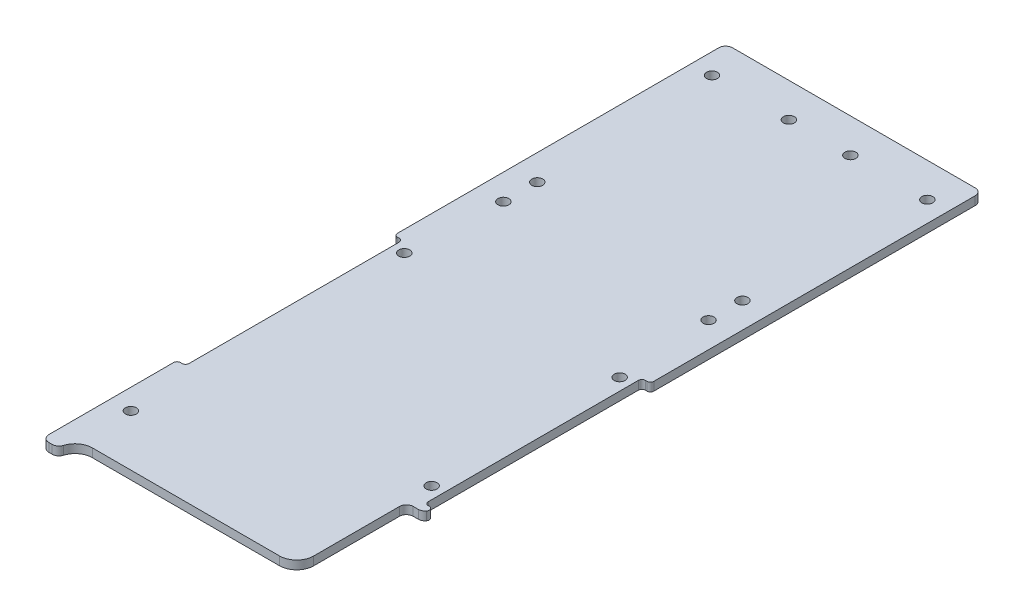
from build123d import *

# Parameters (mm, degrees)
SKETCH1_R               = 2.032
BOSS_EXTRUDE1_DEPTH     = 3.175
FILLET1_R               = 2.54
FILLET2_R               = 2.54
FILLET3_R               = 6.35
CUT_EXTRUDE1_DEPTH      = 136.673215063
FILLET4_R               = 6.35
FILLET5_R               = 2.54
SKETCH3_R               = 2.032
CUT_EXTRUDE2_DEPTH      = 136.673215063
CUT_EXTRUDE3_DEPTH      = 136.673215063
CUT_EXTRUDE3_DEPTH_BACK = 136.673215063
SKETCH4_W               = 3.175
SKETCH4_H               = 80.645
FILLET6_R               = 1.27


with BuildPart() as part:
    # Sketch1 → Boss-Extrude1 (new body)
    with BuildSketch(Plane(origin=(0, 0, 0), x_dir=(1, 0, 0), z_dir=(0, 1, 0))):
        Polygon((47.625, 127), (-47.625, 127), (-47.625, -127), (-41.275, -127), (-41.275, -120.65), (41.275, -120.65), (41.275, -127), (47.625, -127), align=None)
        with Locations((-39.999684148, -101.6)):
            Circle(SKETCH1_R, mode=Mode.SUBTRACT)
        with Locations((39.999684148, -69.85)):
            Circle(SKETCH1_R, mode=Mode.SUBTRACT)
        with Locations((-39.999684148, 0)):
            Circle(SKETCH1_R, mode=Mode.SUBTRACT)
        with Locations((-39.999684148, 114.3)):
            Circle(SKETCH1_R, mode=Mode.SUBTRACT)
        with Locations((-11.424684148, 114.3)):
            Circle(SKETCH1_R, mode=Mode.SUBTRACT)
        with Locations((39.999684148, 0)):
            Circle(SKETCH1_R, mode=Mode.SUBTRACT)
        with Locations((11.424684148, 114.3)):
            Circle(SKETCH1_R, mode=Mode.SUBTRACT)
        with Locations((39.999684148, 114.3)):
            Circle(SKETCH1_R, mode=Mode.SUBTRACT)
    extrude(amount=BOSS_EXTRUDE1_DEPTH)

    # Fillet1
    fillet1_edges = [part.edges().sort_by_distance(p)[0] for p in [
        (-47.625, 1.5875, -127),
        (47.625, 1.5875, -127),
        (47.625, 1.5875, 127),
        (-47.625, 1.5875, 127),
    ]]
    fillet(fillet1_edges, radius=FILLET1_R)

    # Fillet2
    fillet2_edges = [part.edges().sort_by_distance(p)[0] for p in [
        (41.275, 1.5875, 127),
        (-41.275, 1.5875, 127),
    ]]
    fillet(fillet2_edges, radius=FILLET2_R)

    # Fillet3
    fillet3_edges = [part.edges().sort_by_distance(p)[0] for p in [
        (41.275, 1.5875, 120.65),
        (-41.275, 1.5875, 120.65),
    ]]
    fillet(fillet3_edges, radius=FILLET3_R)

    # Sketch2 → Cut-Extrude1 (cut, through all)
    with BuildSketch(Plane.XZ):
        with BuildLine():
            Line((40.64508, 123.578690235), (40.64508, 79.88808))
            Line((40.64508, 79.88808), (47.625, 79.88808))
            Line((47.625, 79.88808), (47.625, 124.46))
            ThreePointArc((47.625, 124.46), (46.881051224, 126.256051224), (45.085, 127))
            Line((45.085, 127), (43.815, 127))
            ThreePointArc((43.815, 127), (42.297059666, 126.496530663), (41.380880287, 125.185714286))
            ThreePointArc((41.380880287, 125.185714286), (41.069166069, 124.356476684), (40.64508, 123.578690235))
        make_face()
    extrude(amount=-CUT_EXTRUDE1_DEPTH, mode=Mode.SUBTRACT)

    # Fillet4
    fillet4_edges = [part.edges().sort_by_distance(p)[0] for p in [
        (40.64508, 1.5875, 123.578690235),
    ]]
    fillet(fillet4_edges, radius=FILLET4_R)

    # Fillet5
    fillet5_edges = [part.edges().sort_by_distance(p)[0] for p in [
        (47.625, 1.5875, 79.88808),
        (40.64508, 1.5875, 79.88808),
    ]]
    fillet(fillet5_edges, radius=FILLET5_R)

    # Sketch3 → Cut-Extrude2 (cut, through all)
    with BuildSketch(Plane.XZ):
        with Locations((-38.10544597, -34.913768806)):
            Circle(SKETCH3_R)
        with Locations((-38.10544597, -47.490173279)):
            Circle(SKETCH3_R)
        with Locations((38.10544597, -47.490173279)):
            Circle(SKETCH3_R)
        with Locations((38.10544597, -34.913768806)):
            Circle(SKETCH3_R)
    extrude(amount=-CUT_EXTRUDE2_DEPTH, mode=Mode.SUBTRACT)

    # Sketch4 → Cut-Extrude3 (cut, two sides: drawn at the far end of the back side and taken through both)
    with BuildSketch(Plane(origin=(0, 3.175, 0), x_dir=(1, 0, 0), z_dir=(0, 1, 0)).offset(-CUT_EXTRUDE3_DEPTH_BACK)):
        with Locations((-46.0375, -36.5125)):
            Rectangle(SKETCH4_W, SKETCH4_H)
        with Locations((46.0375, -36.5125)):
            Rectangle(SKETCH4_W, SKETCH4_H)
    extrude(amount=CUT_EXTRUDE3_DEPTH + CUT_EXTRUDE3_DEPTH_BACK, mode=Mode.SUBTRACT)

    # Fillet6
    fillet6_edges = [part.edges().sort_by_distance(p)[0] for p in [
        (-44.45, 1.5875, -3.81),
        (-47.625, 1.5875, -3.81),
        (-47.625, 1.5875, 76.835),
        (-44.45, 1.5875, 76.835),
        (44.45, 1.5875, 76.835),
        (47.625, 1.5875, 76.835),
        (44.45, 1.5875, -3.81),
        (47.625, 1.5875, -3.81),
    ]]
    fillet(fillet6_edges, radius=FILLET6_R)


solid = part.part
